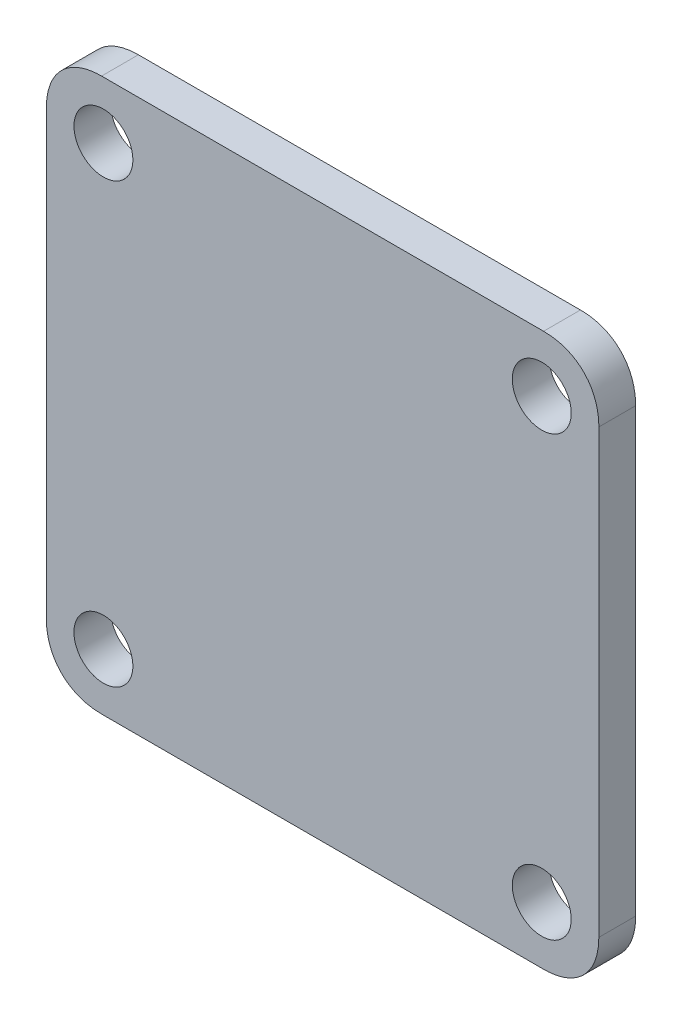
from build123d import *

# Parameters (mm, degrees)
SKETCH_1_W      = 30
SKETCH_1_H      = 30
SKETCH_1_R      = 1.6
EXTRUDE_1_DEPTH = 2
FILLET_1_SIZE   = 3


with BuildPart() as part:
    # 草图1 → 凸台-拉伸1 (new body)
    with BuildSketch(Plane.XY):
        Rectangle(SKETCH_1_W, SKETCH_1_H)
        with Locations((-11.899958033, 11.899958033)):
            Circle(SKETCH_1_R, mode=Mode.SUBTRACT)
        with Locations(Location((11.899958033, 11.899958033, 0), (0, 0, 180))):
            Circle(SKETCH_1_R, mode=Mode.SUBTRACT)
        with Locations((11.899958033, -11.899958033)):
            Circle(SKETCH_1_R, mode=Mode.SUBTRACT)
        with Locations(Location((-11.899958033, -11.899958033, 0), (0, 0, 180))):
            Circle(SKETCH_1_R, mode=Mode.SUBTRACT)
    extrude(amount=EXTRUDE_1_DEPTH)

    # 圆角1
    # a fillet whose section is not a circle: 3 mm, written as the material it takes off along each edge
    with BuildSketch(Plane(origin=(-15, -15, -7.5), x_dir=(1, 0, 0), z_dir=(0, 0, 1)), Plane(origin=(15, -15, -7.5), x_dir=(0, 1, 0), z_dir=(0, 0, 1)), Plane(origin=(15, 15, -7.5), x_dir=(-1, 0, 0), z_dir=(0, 0, 1))) as fillet_1_piece_1:
        with BuildLine():
            Bezier((FILLET_1_SIZE, 0), (0, 0), (0, FILLET_1_SIZE), weights=[1, 0.818181818, 1])
            Line((0, FILLET_1_SIZE), (0, 0))
            Line((0, 0), (FILLET_1_SIZE, 0))
        make_face()
    extrude(amount=17, mode=Mode.SUBTRACT)
    with BuildSketch(Plane(origin=(-15, 15, -7.5), x_dir=(1, 0, 0), z_dir=(0, 0, 1))) as fillet_1_piece_2:
        with BuildLine():
            Bezier((FILLET_1_SIZE, 0), (0, 0), (0, -FILLET_1_SIZE), weights=[1, 0.818181818, 1])
            Line((0, -FILLET_1_SIZE), (0, 0))
            Line((0, 0), (FILLET_1_SIZE, 0))
        make_face()
    extrude(amount=17, mode=Mode.SUBTRACT)


solid = part.part
